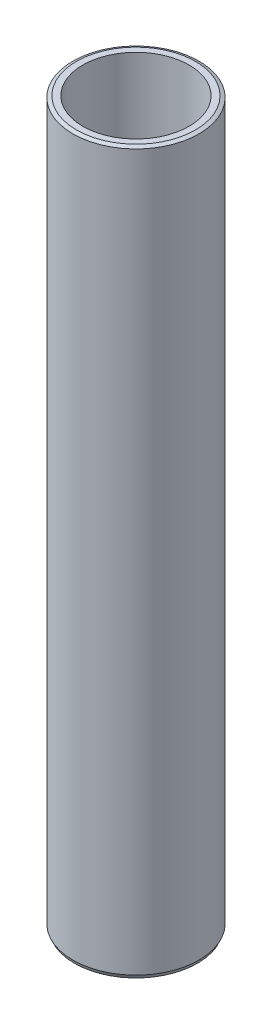
from build123d import *
from OCP.BRepFilletAPI import BRepFilletAPI_MakeChamfer

# Parameters (mm, degrees)
SKETCH1_R           = 52.5
BOSS_EXTRUDE1_DEPTH = 600
SKETCH2_R           = 44.241418605
CUT_EXTRUDE1_DEPTH  = 605.576297914
CHAMFER1_SIZE       = 1.325290363
CHAMFER1_SIZE2      = 2.992660013


with BuildPart() as part:
    # Sketch1 → Boss-Extrude1 (new body)
    with BuildSketch(Plane(origin=(0, 0, 0), x_dir=(1, 0, 0), z_dir=(0, 1, 0))):
        Circle(SKETCH1_R)
    extrude(amount=BOSS_EXTRUDE1_DEPTH)

    # Sketch2 → Cut-Extrude1 (cut, through all)
    with BuildSketch(Plane(origin=(0, 0, 0), x_dir=(1, 0, 0), z_dir=(0, 1, 0))):
        Circle(SKETCH2_R)
    extrude(amount=CUT_EXTRUDE1_DEPTH, mode=Mode.SUBTRACT)

    # Chamfer1: one chamfer whose edges measure the first distance from different faces: ONE call of the kernel's chamfer builder (chamfer() names one face for all edges)
    chamfer1_edges_1 = [part.edges().sort_by_distance(p)[0] for p in [
        (-52.5, 600, 0),
    ]]
    chamfer1_side_1 = [part.faces().sort_by_distance(p)[0] for p in [
        (-52.5, 300, 0),
    ]]
    chamfer1_edges_2 = [part.edges().sort_by_distance(p)[0] for p in [
        (-52.5, 0, 0),
    ]]
    chamfer1_side_2 = [part.faces().sort_by_distance(p)[0] for p in [
        (-51.01507576, 0, 0),
    ]]
    chamfer1 = BRepFilletAPI_MakeChamfer(part.part.solid().wrapped)
    for e in chamfer1_edges_1:
        chamfer1.Add(CHAMFER1_SIZE, CHAMFER1_SIZE2, e.wrapped, chamfer1_side_1[0].wrapped)  # the first distance lies on this face
    for e in chamfer1_edges_2:
        chamfer1.Add(CHAMFER1_SIZE, CHAMFER1_SIZE2, e.wrapped, chamfer1_side_2[0].wrapped)  # the first distance lies on this face
    add(Compound.cast(chamfer1.Shape()), mode=Mode.REPLACE)


solid = part.part
